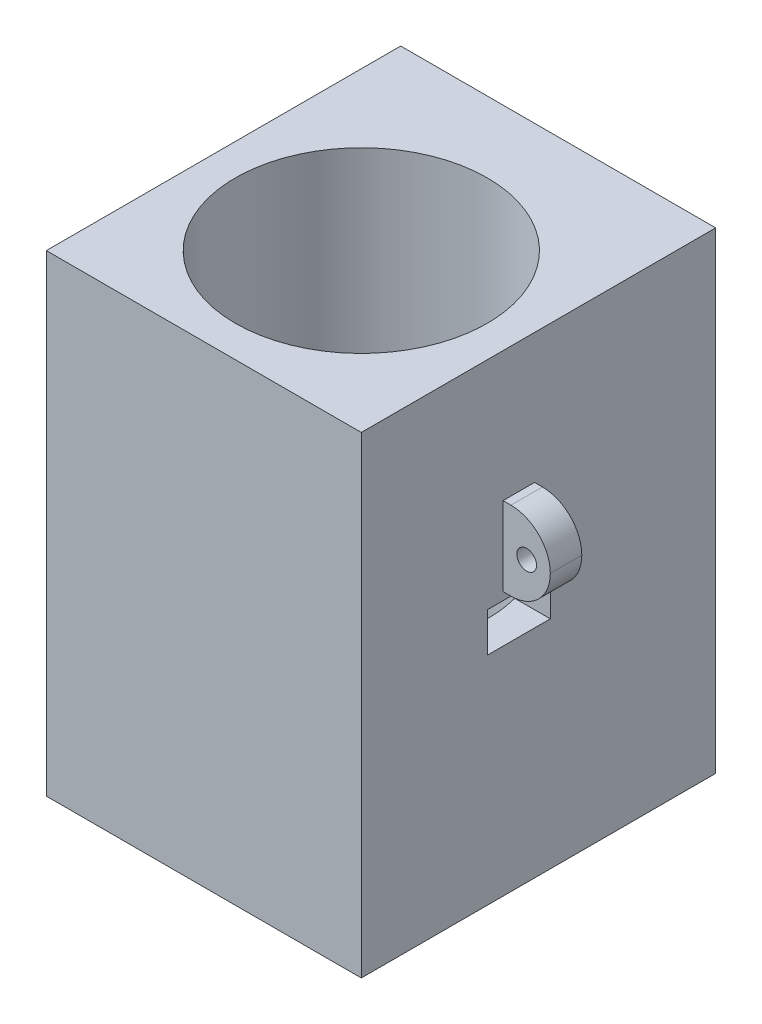
from build123d import *

# Parameters (mm, degrees)
CROQUIS1_W              = 40
CROQUIS1_H              = 45
CROQUIS1_R              = 16
SALIENTE_EXTRUIR1_DEPTH = 30
CROQUIS3_W              = 8
CROQUIS3_H              = 5
CORTAR_EXTRUIR1_DEPTH   = 40
CROQUIS4_W              = 6
CROQUIS4_H              = 10
CROQUIS4_R              = 1.25
SALIENTE_EXTRUIR2_DEPTH = 2
REDONDEO1_R             = 5


with BuildPart() as part:
    # Croquis1 → Saliente-Extruir1 (new, symmetric)
    with BuildSketch(Plane(origin=(0, 0, 0), x_dir=(1, 0, 0), z_dir=(0, 1, 0))):
        with Locations((0, 2.5)):
            Rectangle(CROQUIS1_W, CROQUIS1_H)
        with Locations(Location((0, 0, 0), (0, 0, 90))):
            Circle(CROQUIS1_R, mode=Mode.SUBTRACT)
    extrude(amount=SALIENTE_EXTRUIR1_DEPTH, both=True)

    # Croquis3 → Cortar-Extruir1 (cut, symmetric)
    with BuildSketch(Plane(origin=(0, 0, 0), x_dir=(0, 0, -1), z_dir=(1, 0, 0))):
        Rectangle(CROQUIS3_W, CROQUIS3_H)
    extrude(amount=CORTAR_EXTRUIR1_DEPTH, both=True, mode=Mode.SUBTRACT)

    # Croquis4 → Saliente-Extruir2 (add, symmetric)
    # profile 1 of 2: a face of its own
    with BuildSketch(Plane.XY):
        with Locations((-23, 8.5)):
            Rectangle(CROQUIS4_W, CROQUIS4_H)
        with Locations((-23, 8.5)):
            Circle(CROQUIS4_R, mode=Mode.SUBTRACT)
    # profile 2 of 2: a face of its own
    with BuildSketch(Plane.XY):
        with Locations((23, 8.5)):
            Rectangle(CROQUIS4_W, CROQUIS4_H)
        with Locations(Location((23, 8.5, 0), (0, 0, 180))):
            Circle(CROQUIS4_R, mode=Mode.SUBTRACT)
    extrude(amount=SALIENTE_EXTRUIR2_DEPTH, both=True)

    # Redondeo1
    redondeo1_edges = [part.edges().sort_by_distance(p)[0] for p in [
        (26, 3.5, 0),
        (26, 13.5, 0),
        (-26, 3.5, 0),
        (-26, 13.5, 0),
    ]]
    fillet(redondeo1_edges, radius=REDONDEO1_R - 0.0001)  # a hair under: the kernel refuses the full size


solid = part.part
